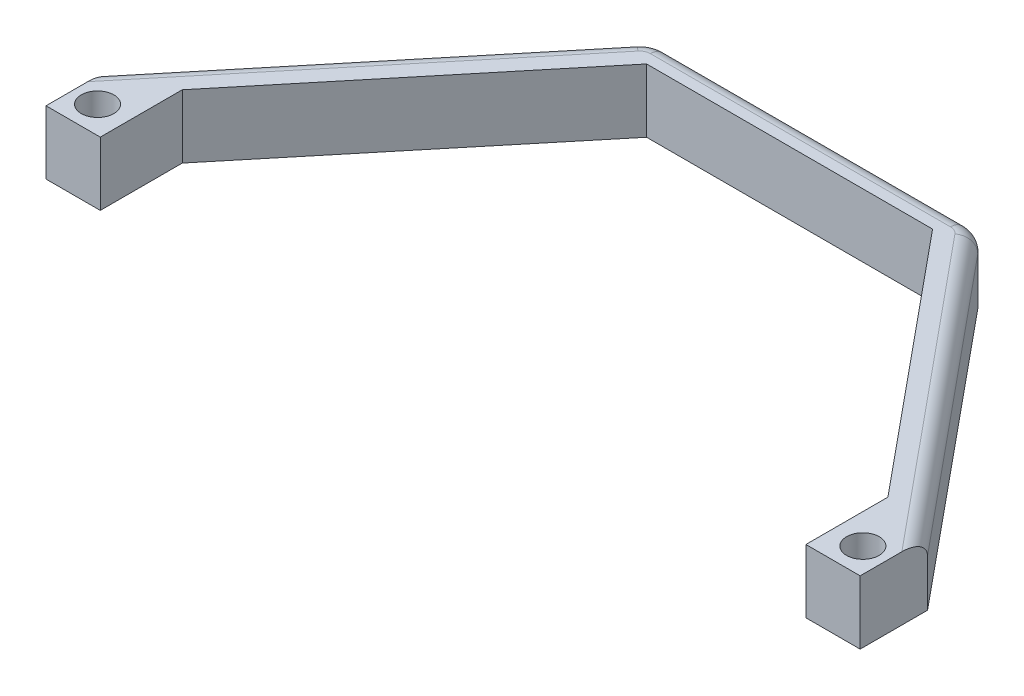
from build123d import *

# Parameters (mm, degrees)
SKETCH1_R               = 1.65
BOSS_EXTRUDE1_DEPTH     = 11.7
CUT_EXTRUDE1_DEPTH      = 51
CUT_EXTRUDE1_DEPTH_BACK = 10
FILLET1_R               = 3
FILLET2_R               = 5
SKETCH3_R               = 3
CUT_EXTRUDE2_DEPTH      = 5.7


with BuildPart() as part:
    # Sketch1 → Boss-Extrude1 (new body)
    with BuildSketch(Plane(origin=(0, 0, 0), x_dir=(1, 0, 0), z_dir=(0, 1, 0))):
        Polygon((-22.5, 37), (22.5, 37), (53, 0), (75, 0), (75, 12.409836066), (30, 67), (-30, 67), (-75, 12.409836066), (-75, 0), (-53, 0), align=None)
        with Locations(Location((70.5, 5, 0), (0, 0, 270))):
            Circle(SKETCH1_R, mode=Mode.SUBTRACT)
        with Locations(Location((-70.5, 5, 0), (0, 0, 270))):
            Circle(SKETCH1_R, mode=Mode.SUBTRACT)
    extrude(amount=BOSS_EXTRUDE1_DEPTH)

    # Sketch2 → Cut-Extrude1 (cut, two sides: drawn at the far end of the back side and taken through both)
    with BuildSketch(Plane(origin=(0, 0, 0), x_dir=(1, 0, 0), z_dir=(0, 1, 0)).offset(-CUT_EXTRUDE1_DEPTH_BACK)):
        Polygon((-65, 15.108099284), (-65, 0), (-53, 0), (-22.5, 37), (0, 37), (0, 62), (-26.345865626, 62), align=None)
        Polygon((26.345865626, 62), (0, 62), (0, 37), (22.5, 37), (53, 0), (65, 0), (65, 15.108099284), align=None)
    extrude(amount=CUT_EXTRUDE1_DEPTH + CUT_EXTRUDE1_DEPTH_BACK, mode=Mode.SUBTRACT)

    # Fillet1
    fillet1_edges = [part.edges().sort_by_distance(p)[0] for p in [
        (52.5, 11.7, -39.704918033),
        (0, 11.7, -67),
        (-52.5, 11.7, -39.704918033),
    ]]
    fillet(fillet1_edges, radius=FILLET1_R)

    # Fillet2
    # the kernel refuses this fillet: 5 mm, written as the material it takes off along each edge
    with BuildSketch(Plane(origin=(27.641824959, 11.7, -62), x_dir=(0.7716291513697928, 0, -0.6360726788318559), z_dir=(0.6360726788318559, 0, 0.7716291513697928))) as fillet2_piece_1:
        with BuildLine():
            CenterArc((2, -3), 3, 0, 90)
            Line((5, -3), (5, 0))
            Line((5, 0), (2, 0))
        make_face()
    revolve(axis=Axis((27.641824959, 11.7, -62), (0, 1, 0)), revolution_arc=50.50041147, mode=Mode.SUBTRACT)
    with BuildSketch(Plane(origin=(-27.641824959, 11.7, -62), x_dir=(0, 0, -1), z_dir=(1, 0, 0))) as fillet2_piece_2:
        with BuildLine():
            CenterArc((2, -3), 3, 0, 90)
            Line((5, -3), (5, 0))
            Line((5, 0), (2, 0))
        make_face()
    revolve(axis=Axis((-27.641824959, 11.7, -62), (0, 1, 0)), revolution_arc=50.50041147, mode=Mode.SUBTRACT)
    with BuildSketch(Plane(origin=(-30, -5.895437603, -67), x_dir=(-0.6360726788318558, 0, 0.771629151369793), z_dir=(0, 1, 0)), Plane(origin=(30, -5.895437603, -67), x_dir=(-1, 0, 0), z_dir=(0, 1, 0))) as fillet2_piece_3:
        with BuildLine():
            CenterArc((FILLET2_R * 0.471635008245, FILLET2_R), FILLET2_R, 219.49958853, 50.50041147)
            Line((-FILLET2_R * 0.299994143125, FILLET2_R * 0.363927321168), (0, 0))
            Line((0, 0), (FILLET2_R * 0.471635008245, 0))
        make_face()
    extrude(amount=17.595437603, mode=Mode.SUBTRACT)

    # Sketch3 → Cut-Extrude2 (cut)
    with BuildSketch(Plane(origin=(0, 11.7, 0), x_dir=(1, 0, 0), z_dir=(0, 1, 0))):
        with Locations(Location((-70.5, 5, 0), (0, 0, 270))):
            Circle(SKETCH3_R)
        with Locations(Location((70.5, 5, 0), (0, 0, 270))):
            Circle(SKETCH3_R)
    extrude(amount=-CUT_EXTRUDE2_DEPTH, mode=Mode.SUBTRACT)


solid = part.part
